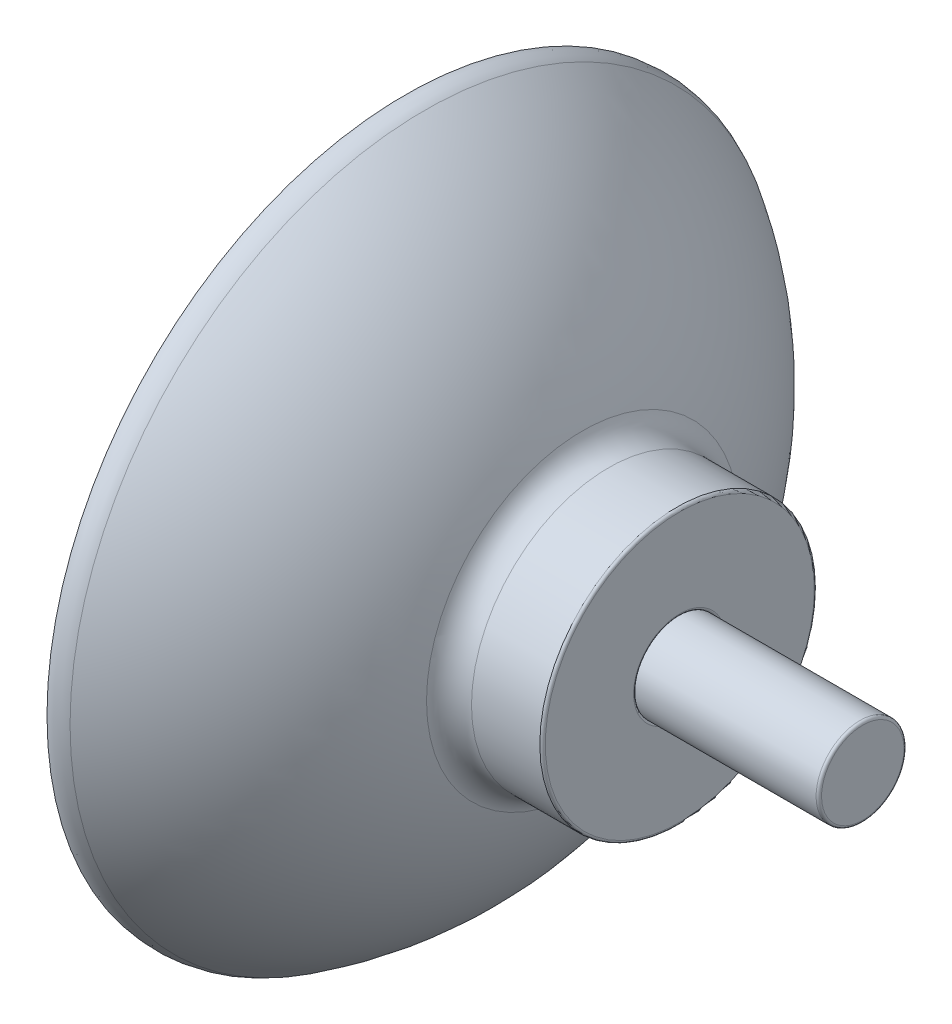
from build123d import *

# Parameters (mm, degrees)
ZAOKR_GLENIE1_R = 0.15
ZAOKR_GLENIE2_R = 1.5
ZAOKR_GLENIE3_R = 0.15


with BuildPart() as part:
    # Szkic1 → Obrót1 (revolve)
    with BuildSketch(Plane(origin=(0, 0, 0), x_dir=(1, 0, 0), z_dir=(0, 1, 0))):
        with BuildLine():
            Line((0, 4), (0, 0))
            Line((0, 0), (2, 0))
            Line((2, 0), (2, 4.75))
            Line((2, 4.75), (4, 4.75))
            Line((4, 4.75), (4, 2.375))
            Line((4, 2.375), (5, 2.375))
            Line((5, 2.375), (5, 7.5))
            Line((5, 7.5), (0, 7.5))
            ThreePointArc((0, 7.5), (-3.694854211, 14.794116631), (-10, 20))
            Line((-10, 20), (-10, 19.5))
            ThreePointArc((-10, 19.5), (-3.297071482, 12.84866356), (0, 4))
        make_face()
    revolve(axis=Axis((0, 0, 0), (-1, 0, 0)))

    # Zaokrąglenie1
    zaokr_glenie1_edges = [part.edges().sort_by_distance(p)[0] for p in [
        (0, 0, 4),
        (-10, 0, 19.5),
        (5, 0, 7.5),
        (5, 0, 2.375),
        (4, 0, 2.375),
    ]]
    fillet(zaokr_glenie1_edges, radius=ZAOKR_GLENIE1_R)

    # Zaokrąglenie2
    # the kernel refuses this fillet: 1.5 mm, written as the material it adds along each edge
    with BuildSketch(Plane(origin=(0, 0, 0), x_dir=(0, 0, -1), z_dir=(0, 1, 0))) as zaokr_glenie2_piece_1:
        with BuildLine():
            CenterArc((9, -1.117230926), ZAOKR_GLENIE2_R, 108.15675825, 71.84324175)
            Line((7.5, -1.117230926), (7.5, 0))
            ThreePointArc((7.5, 0), (8.018361801, 0.147084824), (8.532573187, 0.308080329))
        make_face()
    revolve(axis=Axis((0, 0, 0), (-1, 0, 0)))
    # the kernel refuses this fillet: 1.5 mm, written as the material it takes off along each edge
    with BuildSketch(Plane(origin=(-10, 0, 0), x_dir=(0, 0, -1), z_dir=(0, 1, 0))) as zaokr_glenie2_2_piece_1:
        with BuildLine():
            CenterArc((18.111217478, -0.293092194), ZAOKR_GLENIE2_R, 328.720951381, 42.546835999)
            ThreePointArc((19.393190597, -1.071902134), (19.704849183, -0.540623634), (20, 0))
            Line((20, 0), (19.58230448, 0))
        make_face()
    revolve(axis=Axis((-10, 0, 0), (-1, 0, 0)), mode=Mode.SUBTRACT)


with BuildPart() as body_2:
    # Szkic2 → Obrót2 (revolve)
    with BuildSketch(Plane.XY, mode=Mode.PRIVATE) as obr_t2_sk:
        Polygon((2, 0), (2, 4.75), (4, 4.75), (4, 2.4), (15, 2.4), (15, 0), align=None)
    revolve(obr_t2_sk.sketch.rotate(Axis((15, 0, 0), (-1, 0, 0)), 270), axis=Axis((15, 0, 0), (-1, 0, 0)))

    # Zaokrąglenie3
    zaokr_glenie3_edges = [body_2.edges().sort_by_distance(p)[0] for p in [
        (15, 0, -2.4),
    ]]
    fillet(zaokr_glenie3_edges, radius=ZAOKR_GLENIE3_R)


solid = Compound([part.part, body_2.part])
